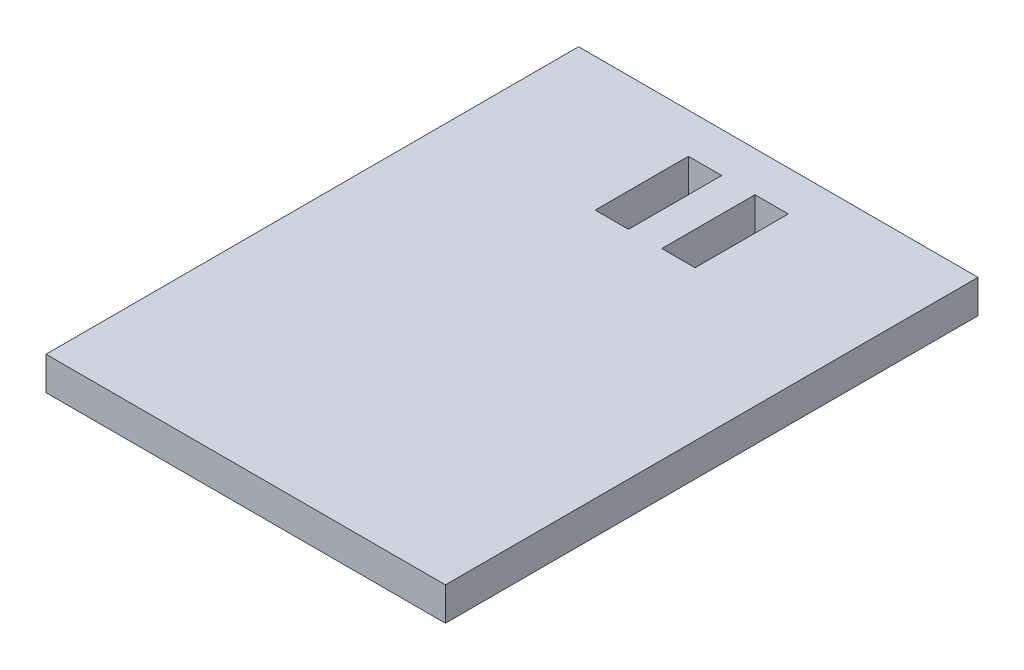
from build123d import *

# Parameters (mm, degrees)
SKETCH1_W           = 38.1
SKETCH1_H           = 50.8
SKETCH1_W_2         = 3.175
SKETCH1_H_2         = 8.89
BOSS_EXTRUDE1_DEPTH = 3.175


with BuildPart() as part:
    # Sketch1 → Boss-Extrude1 (new body)
    with BuildSketch(Plane(origin=(0, 0, 0), x_dir=(1, 0, 0), z_dir=(0, 1, 0))):
        with Locations((19.05, 25.4)):
            Rectangle(SKETCH1_W, SKETCH1_H)
        with Locations((15.875, 42.545)):
            Rectangle(SKETCH1_W_2, SKETCH1_H_2, mode=Mode.SUBTRACT)
        with Locations((22.225, 42.545)):
            Rectangle(SKETCH1_W_2, SKETCH1_H_2, mode=Mode.SUBTRACT)
    extrude(amount=BOSS_EXTRUDE1_DEPTH)


solid = part.part
